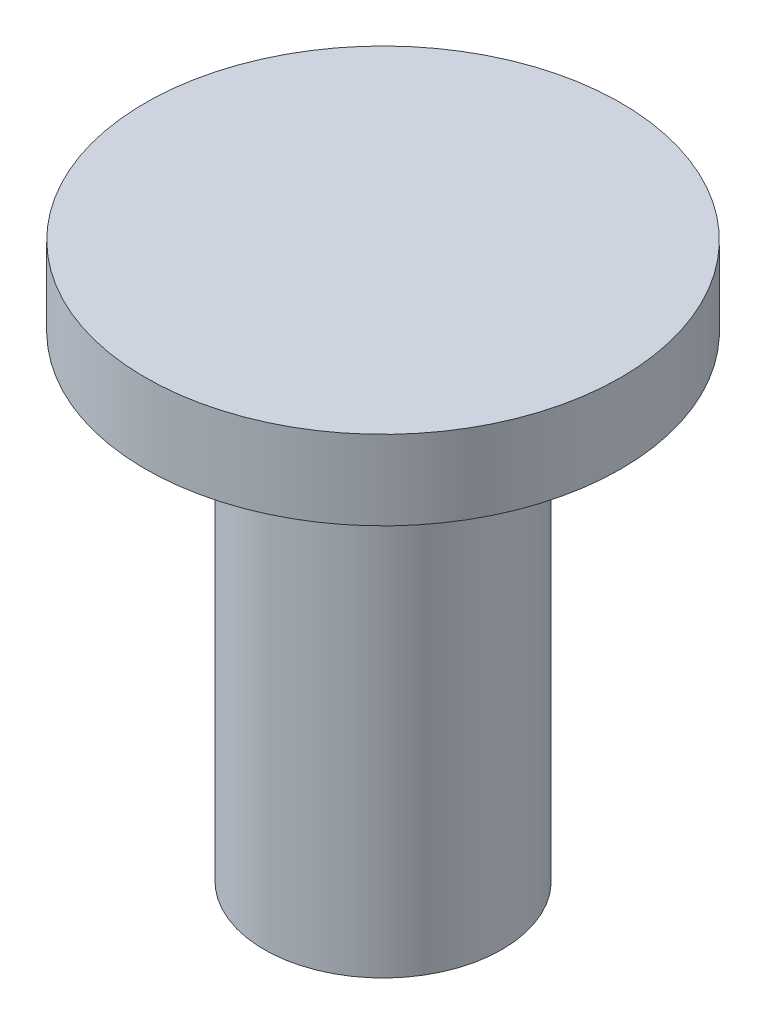
from build123d import *

# Parameters (mm, degrees)
SKETCH1_W   = 1.5
SKETCH1_H   = 7
SKETCH1_3_W = 1.5
SKETCH1_3_H = 1


with BuildPart() as part:
    # Sketch1 → Revolve1 (revolve)
    with BuildSketch(Plane.XY):
        with Locations((0.75, 3.5)):
            Rectangle(SKETCH1_W, SKETCH1_H)
    revolve(axis=Axis((0, 6, 0), (0, 1, 0)))

    # Sketch1<3> → Revolve2 (revolve)
    with BuildSketch(Plane.XY):
        with Locations((2.25, 6.5)):
            Rectangle(SKETCH1_3_W, SKETCH1_3_H)
    revolve(axis=Axis((0, 6, 0), (0, 1, 0)))


solid = part.part
